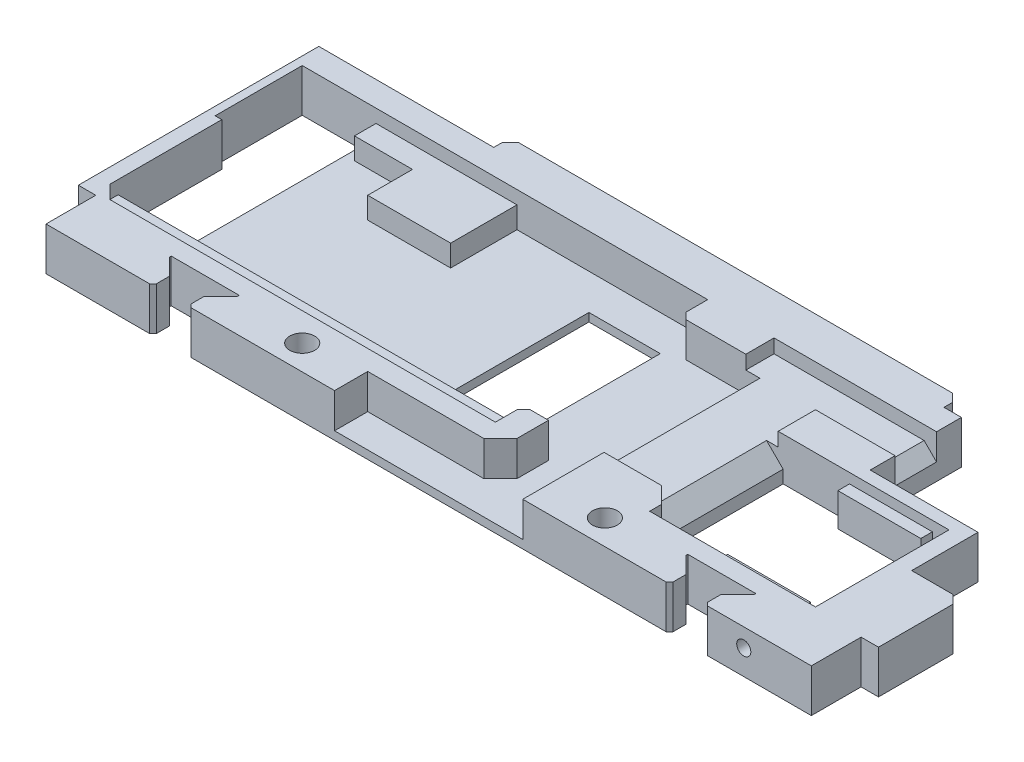
from build123d import *

# Parameters (mm, degrees)
SKETCH_1_W           = 96.5
SKETCH_1_H           = 35
EXTRUDE_1_DEPTH      = 5.2
CUT_EXTRUDE_6_DEPTH  = 1.6
CUT_EXTRUDE_7_DEPTH  = 2.6
CUT_EXTRUDE_15_DEPTH = 5
SKETCH_7_W           = 8
SKETCH_7_H           = 17
CUT_EXTRUDE_16_DEPTH = 103.736994311
SKETCH_8_W           = 18.1
SKETCH_8_H           = 16.1
CUT_EXTRUDE_17_DEPTH = 1.66
CUT_EXTRUDE_18_REACH = 104.712
SKETCH_9_W           = 15.2
SKETCH_9_H           = 16.1
CHAMFER_1_SIZE       = 0.6
SKETCH_10_W          = 12.5
SKETCH_10_H          = 12.7
CUT_EXTRUDE_19_DEPTH = 1.66
CHAMFER_2_SIZE       = 0.8
CUT_EXTRUDE_20_DEPTH = 103.782732013
CHAMFER_4_SIZE       = 1
SKETCH_14_W          = 54.3
SKETCH_14_H          = 2
EXTRUDE_2_DEPTH      = 5.2
CHAMFER_5_SIZE       = 1
CUT_EXTRUDE_21_DEPTH = 1.66
CHAMFER_3_SIZE       = 1.5
CHAMFER_6_SIZE       = 1.6
SKETCH_16_W          = 2.1
SKETCH_16_H          = 6
CUT_EXTRUDE_22_DEPTH = 104.480867797
CUT_EXTRUDE_24_DEPTH = 104.480867797
CHAMFER_11_SIZE      = 2
CHAMFER_10_SIZE      = 0.4
CUT_EXTRUDE_START    = -4.2
SKETCH_21_W          = 6.7
SKETCH_21_H          = 9.8
CUT_EXTRUDE_26_DEPTH = 4.2
CHAMFER_9_SIZE       = 1.7
SKETCH_22_W          = 16
SKETCH_22_H          = 4
CUT_EXTRUDE_27_DEPTH = 4.2
CHAMFER_12_SIZE      = 2
SKETCH_24_R          = 1.5
CUT_EXTRUDE_28_DEPTH = 104.480867797
SKETCH_25_R          = 0.85
CUT_EXTRUDE_29_DEPTH = 3
SKETCH_26_R          = 0.85
CUT_EXTRUDE_30_DEPTH = 4
SKETCH_27_W          = 20
SKETCH_27_H          = 16.1
CUT_EXTRUDE_31_DEPTH = 104.480867797
SKETCH_28_W          = 10
SKETCH_28_H          = 1.4
EXTRUDE_3_DEPTH      = 4
CHAMFER_13_SIZE      = 2
CHAMFER_14_SIZE      = 2


# Some blends are built 0.0001 mm under size
with BuildPart() as part:
    # 草图1 → 凸台-拉伸1 (new body)
    with BuildSketch(Plane(origin=(0, 0, 0), x_dir=(1, 0, 0), z_dir=(0, 1, 0))):
        with Locations((48.25, 17.5)):
            Rectangle(SKETCH_1_W, SKETCH_1_H)
    extrude(amount=EXTRUDE_1_DEPTH)

    # 草图4 → 切除-拉伸6 (cut)
    with BuildSketch(Plane(origin=(0, 5.2, 0), x_dir=(1, 0, 0), z_dir=(0, 1, 0))):
        Polygon((1.8, 6.4), (49.9, 6.4), (49.9, 9.8), (57.9, 9.8), (57.9, 28.6), (49.9, 28.6), (49.9, 32), (1.8, 32), align=None)
    extrude(amount=-CUT_EXTRUDE_6_DEPTH, mode=Mode.SUBTRACT)

    # 草图5 → 切除-拉伸7 (cut)
    with BuildSketch(Plane(origin=(0, 3.6, 0), x_dir=(1, 0, 0), z_dir=(0, 1, 0))):
        Polygon((49.9, 9), (1.8, 9), (1.8, 32), (9.9, 32), (9.9, 29.4), (16.9, 29.4), (16.9, 24), (26.9, 24), (26.9, 32), (49.9, 32), (49.9, 28.6), (57.9, 28.6), (57.9, 9.8), (49.9, 9.8), align=None)
    extrude(amount=-CUT_EXTRUDE_7_DEPTH, mode=Mode.SUBTRACT)

    # 草图6 → 切除-拉伸15 (cut, symmetric)
    with BuildSketch(Plane(origin=(0, 1, 0), x_dir=(1, 0, 0), z_dir=(0, 1, 0))):
        Polygon((3.8, 32), (8.8, 32), (8.8, 9), (1.8, 9), (1.8, 21.5), (1, 21.5), (1, 32), align=None)
    extrude(amount=CUT_EXTRUDE_15_DEPTH, both=True, mode=Mode.SUBTRACT)

    # 草图7 → 切除-拉伸16 (cut, through all)
    with BuildSketch(Plane(origin=(0, 1, 0), x_dir=(1, 0, 0), z_dir=(0, 1, 0))):
        with Locations((43.879, 19.2)):
            Rectangle(SKETCH_7_W, SKETCH_7_H)
    extrude(amount=-CUT_EXTRUDE_16_DEPTH, mode=Mode.SUBTRACT)

    # 草图8 → 切除-拉伸17 (cut)
    with BuildSketch(Plane(origin=(0, 5.2, 0), x_dir=(1, 0, 0), z_dir=(0, 1, 0))):
        with Locations((79.45, 14.45)):
            Rectangle(SKETCH_8_W, SKETCH_8_H)
    extrude(amount=-CUT_EXTRUDE_17_DEPTH, mode=Mode.SUBTRACT)

    # 草图9 → 切除-拉伸18 (cut, up to next)
    with BuildSketch(Plane(origin=(0, 3.54, 0), x_dir=(1, 0, 0), z_dir=(0, 1, 0)), mode=Mode.PRIVATE) as cut_extrude_18_sk1:
        with Locations((79.2, 14.45)):
            Rectangle(SKETCH_9_W, SKETCH_9_H)
    cut_extrude_18_tool1 = extrude(cut_extrude_18_sk1.sketch, amount=-CUT_EXTRUDE_18_REACH, mode=Mode.PRIVATE) & part.part
    add(cut_extrude_18_tool1.solids().sort_by_distance((79.2, 3.54, -14.45))[0], mode=Mode.SUBTRACT)

    # 倒角1
    chamfer_1_edges = [part.edges().sort_by_distance(p)[0] for p in [
        (47.879, 1, -19.2),
    ]]
    chamfer(chamfer_1_edges, length=CHAMFER_1_SIZE)

    # 草图10 → 切除-拉伸19 (cut)
    with BuildSketch(Plane(origin=(0, 5.2, 0), x_dir=(1, 0, 0), z_dir=(0, 1, 0))):
        with Locations((64.15, 16.15)):
            Rectangle(SKETCH_10_W, SKETCH_10_H)
    extrude(amount=-CUT_EXTRUDE_19_DEPTH, mode=Mode.SUBTRACT)

    # 倒角2
    chamfer_2_edges = [part.edges().sort_by_distance(p)[0] for p in [
        (49.9, 3.1, -28.6),
        (49.9, 3.1, -9.8),
    ]]
    chamfer(chamfer_2_edges, length=CHAMFER_2_SIZE)

    # 草图12 → 切除-拉伸20 (cut, through all)
    with BuildSketch(Plane(origin=(0, 5.2, 0), x_dir=(1, 0, 0), z_dir=(0, 1, 0))):
        Polygon((96.5, 35), (77.5, 35), (77.5, 24), (90.5, 24), (90.5, 16), (96.5, 16), align=None)
    extrude(amount=-CUT_EXTRUDE_20_DEPTH, mode=Mode.SUBTRACT)

    # 倒角4
    chamfer_4_edges = [part.edges().sort_by_distance(p)[0] for p in [
        (96.5, 2.6, -16),
    ]]
    chamfer(chamfer_4_edges, length=CHAMFER_4_SIZE)

    # 草图14 → 凸台-拉伸2 (add)
    with BuildSketch(Plane(origin=(0, 5.2, 0), x_dir=(1, 0, 0), z_dir=(0, 1, 0))):
        with Locations((48.25, 36)):
            Rectangle(SKETCH_14_W, SKETCH_14_H)
    extrude(amount=-EXTRUDE_2_DEPTH)

    # 倒角5
    chamfer_5_edges = [part.edges().sort_by_distance(p)[0] for p in [
        (21.1, 2.6, -37),
        (75.4, 2.6, -37),
    ]]
    chamfer(chamfer_5_edges, length=CHAMFER_5_SIZE)

    # 草图15 → 切除-拉伸21 (cut)
    with BuildSketch(Plane(origin=(0, 5.2, 0), x_dir=(1, 0, 0), z_dir=(0, 1, 0))):
        Polygon((77.5, 32), (57.9, 32), (57.9, 30.602488817), (57.9, 22.5), (67.9, 22.5), (67.9, 27), (77.5, 27), align=None)
    extrude(amount=-CUT_EXTRUDE_21_DEPTH, mode=Mode.SUBTRACT)

    # 倒角3
    chamfer_3_edges = [part.edges().sort_by_distance(p)[0] for p in [
        (77.5, 3.54, -29.5),
    ]]
    chamfer(chamfer_3_edges, length=CHAMFER_3_SIZE)

    # 倒角6
    chamfer_6_edges = [part.edges().sort_by_distance(p)[0] for p in [
        (1.8, 4.4, -6.4),
    ]]
    chamfer(chamfer_6_edges, length=CHAMFER_6_SIZE)

    # 草图16 → 切除-拉伸22 (cut, through all)
    with BuildSketch(Plane(origin=(0, 5.2, 0), x_dir=(1, 0, 0), z_dir=(0, 1, 0))):
        with Locations((1.05, 3)):
            Rectangle(SKETCH_16_W, SKETCH_16_H)
        with Locations((95.45, 3)):
            Rectangle(SKETCH_16_W, SKETCH_16_H)
    extrude(amount=-CUT_EXTRUDE_22_DEPTH, mode=Mode.SUBTRACT)

    # 草图19 → 切除-拉伸24 (cut, through all)
    with BuildSketch(Plane(origin=(0, 5.2, 0), x_dir=(1, 0, 0), z_dir=(0, 1, 0))):
        Polygon((15, 0), (19.2, 0), (19.2, 2), (21.2, 2), (21.2, 4.2), (13, 4.2), (13, 2), (15, 2), align=None)
        Polygon((77.3, 2), (77.3, 0), (81.5, 0), (81.5, 2), (83.5, 2), (83.5, 4.2), (75.3, 4.2), (75.3, 2), align=None)
    extrude(amount=-CUT_EXTRUDE_24_DEPTH, mode=Mode.SUBTRACT)

    # 倒角11
    chamfer_11_edges = [part.edges().sort_by_distance(p)[0] for p in [
        (83.5, 2.6, -2),
        (75.3, 2.6, -2),
        (21.2, 2.6, -2),
        (13, 2.6, -2),
    ]]
    chamfer(chamfer_11_edges, length=CHAMFER_11_SIZE - 0.0001)  # a hair under: the kernel refuses the full size

    # 倒角10
    chamfer_10_edges = [part.edges().sort_by_distance(p)[0] for p in [
        (19.2, 2.6, 0),
        (15, 2.6, 0),
        (81.5, 2.6, 0),
        (77.3, 2.6, 0),
    ]]
    chamfer(chamfer_10_edges, length=CHAMFER_10_SIZE)

    # 草图21 → 切除-拉伸26 (cut)
    with BuildSketch(Plane(origin=(0, 5.2, 0), x_dir=(1, 0, 0), z_dir=(0, 1, 0)).offset(CUT_EXTRUDE_START)):
        with Locations((56.25, 4.9)):
            Rectangle(SKETCH_21_W, SKETCH_21_H)
    extrude(amount=CUT_EXTRUDE_26_DEPTH, mode=Mode.SUBTRACT)

    # 倒角9
    chamfer_9_edges = [part.edges().sort_by_distance(p)[0] for p in [
        (57.9, 3.54, -19.2),
        (58.75, 3.54, -9.8),
    ]]
    chamfer(chamfer_9_edges, length=CHAMFER_9_SIZE - 0.0001)  # a hair under: the kernel refuses the full size

    # 草图22 → 切除-拉伸27 (cut)
    with BuildSketch(Plane(origin=(0, 5.2, 0), x_dir=(1, 0, 0), z_dir=(0, 1, 0))):
        with Locations((44.9, 2)):
            Rectangle(SKETCH_22_W, SKETCH_22_H)
    extrude(amount=-CUT_EXTRUDE_27_DEPTH, mode=Mode.SUBTRACT)

    # 倒角12
    chamfer_12_edges = [part.edges().sort_by_distance(p)[0] for p in [
        (52.9, 3.1, -4),
    ]]
    chamfer(chamfer_12_edges, length=CHAMFER_12_SIZE)

    # 草图24 → 切除-拉伸28 (cut, through all)
    with BuildSketch(Plane(origin=(0, 5.2, 0), x_dir=(1, 0, 0), z_dir=(0, 1, 0))):
        with Locations(Location((30, 3, 0), (0, 0, 270))):
            Circle(SKETCH_24_R)
        with Locations(Location((66.5, 3, 0), (0, 0, 270))):
            Circle(SKETCH_24_R)
    extrude(amount=-CUT_EXTRUDE_28_DEPTH, mode=Mode.SUBTRACT)

    # 草图25 → 切除-拉伸29 (cut)
    with BuildSketch(Plane(origin=(0, 0, -35), x_dir=(-1, 0, 0), z_dir=(0, 0, -1))):
        with Locations((-10.2, 2.6)):
            Circle(SKETCH_25_R)
    extrude(amount=-CUT_EXTRUDE_29_DEPTH, mode=Mode.SUBTRACT)

    # 草图26 → 切除-拉伸30 (cut)
    with BuildSketch(Plane.XY):
        with Locations((86.25, 3)):
            Circle(SKETCH_26_R)
    extrude(amount=-CUT_EXTRUDE_30_DEPTH, mode=Mode.SUBTRACT)

    # 草图27 → 切除-拉伸31 (cut, through all)
    with BuildSketch(Plane(origin=(0, 5.2, 0), x_dir=(1, 0, 0), z_dir=(0, 1, 0))):
        with Locations((78.5, 14.45)):
            Rectangle(SKETCH_27_W, SKETCH_27_H)
    extrude(amount=-CUT_EXTRUDE_31_DEPTH, mode=Mode.SUBTRACT)

    # 草图28 → 凸台-拉伸3 (add)
    with BuildSketch(Plane.XZ):
        with Locations((81.5, -7.1)):
            Rectangle(SKETCH_28_W, SKETCH_28_H)
        with Locations((81.5, -21.8)):
            Rectangle(SKETCH_28_W, SKETCH_28_H)
    extrude(amount=-EXTRUDE_3_DEPTH)

    # 倒角13
    chamfer_13_edges = [part.edges().sort_by_distance(p)[0] for p in [
        (68.5, 4.37, -9.8),
    ]]
    chamfer(chamfer_13_edges, length=CHAMFER_13_SIZE)

    # 倒角14
    # the kernel refuses this chamfer: 2 mm, written as the material it takes off along each edge
    with BuildSketch(Plane(origin=(68.5, 3.54, -22.5), x_dir=(-0.9996219169112968, 0.027495876610586414, 0), z_dir=(0, 0, 1))) as chamfer_14_piece_1_section:
        Polygon((CHAMFER_14_SIZE * 0.999621916911, CHAMFER_14_SIZE * 0.0274958766106), (-CHAMFER_14_SIZE * 0.0274958766106, CHAMFER_14_SIZE * 0.999621916911), (0, 0), align=None)
    chamfer_14_piece_1 = extrude(amount=19.843365976, mode=Mode.PRIVATE)
    chamfer_14_piece_1 = split(chamfer_14_piece_1, bisect_by=Plane(origin=(63.791666667, 3.073333333, -12.508333333), z_dir=(0.7071067811865476, 0, -0.7071067811865476)), keep=Keep.TOP, mode=Mode.PRIVATE)
    add(chamfer_14_piece_1, mode=Mode.SUBTRACT)


solid = part.part
